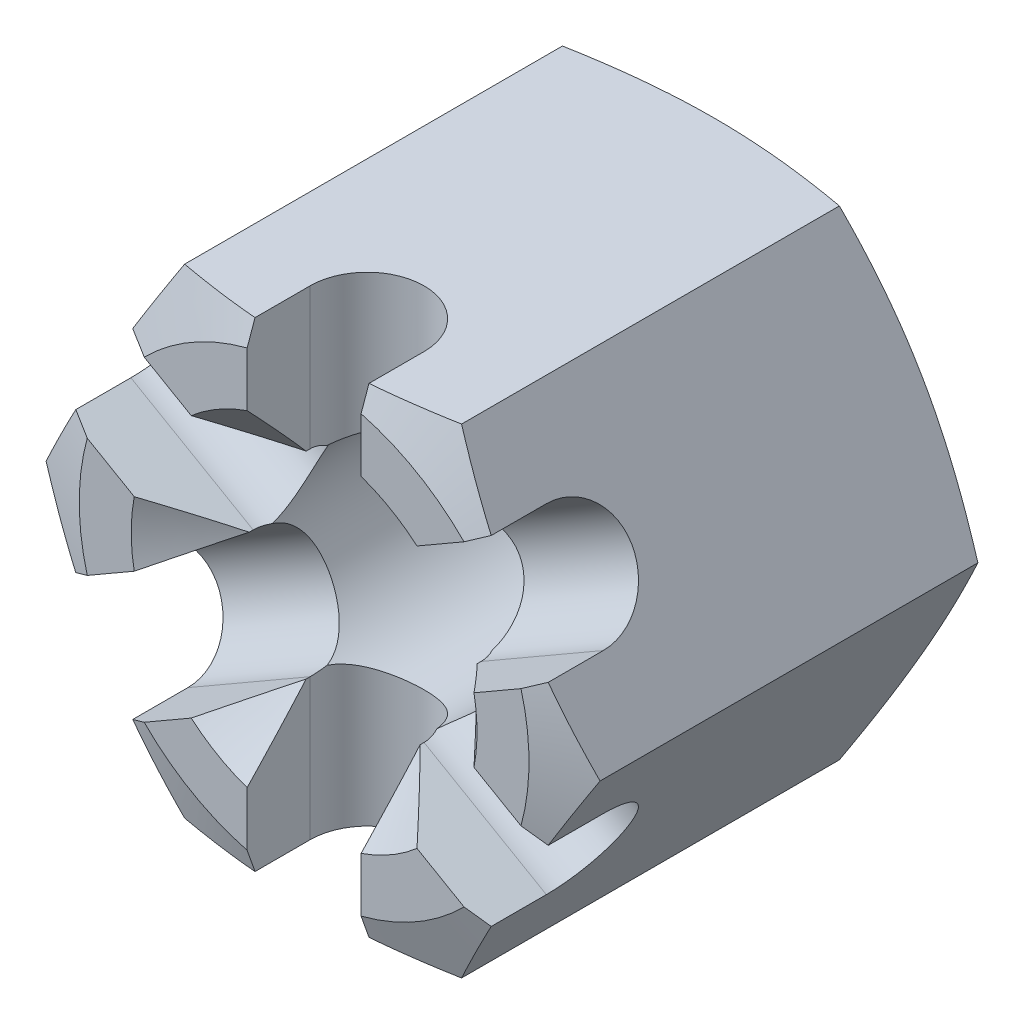
from build123d import *

# Parameters (mm, degrees)
BASENUT_DEPTH     = 20.8
SKETCH3_R         = 5.5
HOLE_DEPTH        = 31.118592353
SLOT_DEPTH        = 39.248765601
SLOTPATTERN_COUNT = 6


with BuildPart() as part:
    # Sketch1 → BaseNut (new body)
    with BuildSketch(Plane.XY):
        Polygon((6.92820323, -12), (13.856406461, 0), (6.92820323, 12), (-6.92820323, 12), (-13.856406461, 0), (-6.92820323, -12), align=None)
    extrude(amount=-BASENUT_DEPTH)

    # Sketch2 → Double-Chamfer (revolve, cut)
    with BuildSketch(Plane(origin=(-3.47179677, 0, -17.32820323), x_dir=(0, 0, -1), z_dir=(0, 1, 0))):
        Polygon((3.47179677, 7.77820323), (2.5231424, 10.384609691), (3.47179677, 10.384609691), align=None)
        Polygon((-17.32820323, 7.77820323), (-17.32820323, 10.384609691), (-16.37954886, 10.384609691), align=None)
    revolve(axis=Axis((0, 0, -17.32820323), (0, 0, 1)), mode=Mode.SUBTRACT)

    # Sketch3 → Hole (cut, through all)
    with BuildSketch(Plane(origin=(2.620769836, -2.247535458, -20.8), x_dir=(-1, 0, 0), z_dir=(0, 0, -1))):
        with Locations((2.620769836, 2.247535458)):
            Circle(SKETCH3_R)
    extrude(amount=-HOLE_DEPTH, mode=Mode.SUBTRACT)

    # Sketch4 → EndChamfer (revolve, cut)
    with BuildSketch(Plane(origin=(-15.758283222, 0, -7.108283222), x_dir=(0, 0, -1), z_dir=(0, 1, 0))):
        Polygon((13.691716778, -24.408283222), (10.541716778, -21.258283222), (13.691716778, -21.258283222), align=None)
        Polygon((-7.108283222, -21.258283222), (-3.958283222, -21.258283222), (-7.108283222, -24.408283222), align=None)
    revolve(axis=Axis((0, 0, -7.108283222), (0, 0, 1)), mode=Mode.SUBTRACT)

    # Sketch5 → Slot (cut, through all)
    with BuildSketch(Plane(origin=(-17.8, 0, -17.8), x_dir=(0, 0, -1), z_dir=(0, 1, 0))):
        with BuildLine():
            Line((-17.8, -14.95), (-14.65, -14.95))
            ThreePointArc((-14.65, -14.95), (-11.8, -17.8), (-14.65, -20.65))
            Line((-14.65, -20.65), (-17.8, -20.65))
            Line((-17.8, -20.65), (-17.8, -14.95))
        make_face()
    slot = extrude(amount=-SLOT_DEPTH, mode=Mode.SUBTRACT)

    # SlotPattern: Slot ×6 about axis
    slotpattern_axis = Axis((0, 0, 0), (0, 0, -1))
    for i in range(1, SLOTPATTERN_COUNT):
        add(slot.rotate(slotpattern_axis, i * 360 / SLOTPATTERN_COUNT), mode=Mode.SUBTRACT)


solid = part.part
